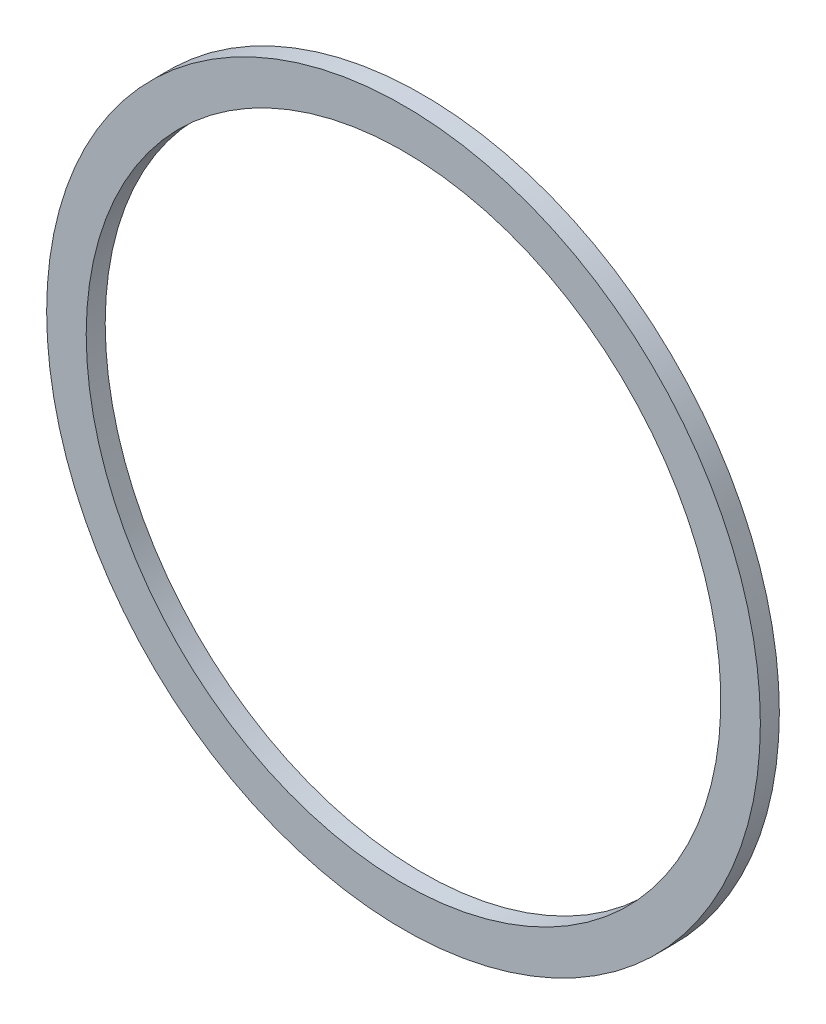
from build123d import *

# Parameters (mm, degrees)
SKETCH1_R           = 57.277
SKETCH1_R_2         = 50.927
BOSS_EXTRUDE1_DEPTH = 3.048


with BuildPart() as part:
    # Sketch1 → Boss-Extrude1 (new body)
    with BuildSketch(Plane.XY):
        Circle(SKETCH1_R)
        Circle(SKETCH1_R_2, mode=Mode.SUBTRACT)
    extrude(amount=BOSS_EXTRUDE1_DEPTH)


solid = part.part
